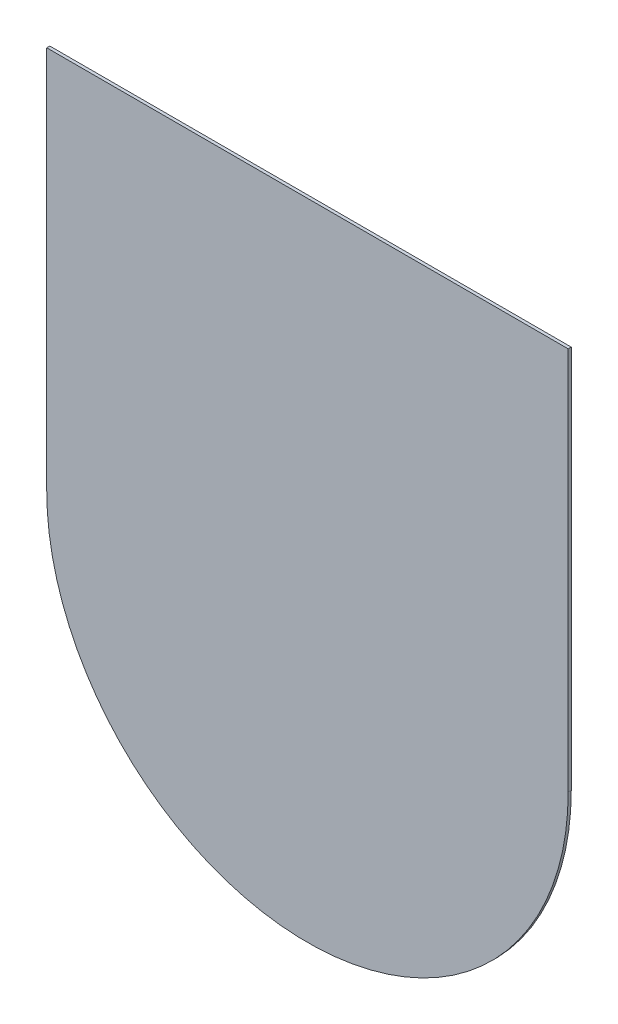
from build123d import *

# Parameters (mm, degrees)
BASE_FLANGE1_DEPTH = 2


# Sheet-metal steps are written as plain solids
with BuildPart() as part:
    # Sketch1 → Base-Flange1 (new body)
    with BuildSketch(Plane(origin=(0, 0, 0), x_dir=(-1, 0, 0), z_dir=(0, 0, 1))):
        with BuildLine():
            Line((-169.8665231, -250), (-169.8665231, 0))
            ThreePointArc((-169.8665231, 0), (0, 169.8665231), (169.8665231, 0))
            Line((169.8665231, 0), (169.8665231, -250))
            Line((169.8665231, -250), (-169.8665231, -250))
        make_face()
    extrude(amount=-BASE_FLANGE1_DEPTH)


solid = part.part
